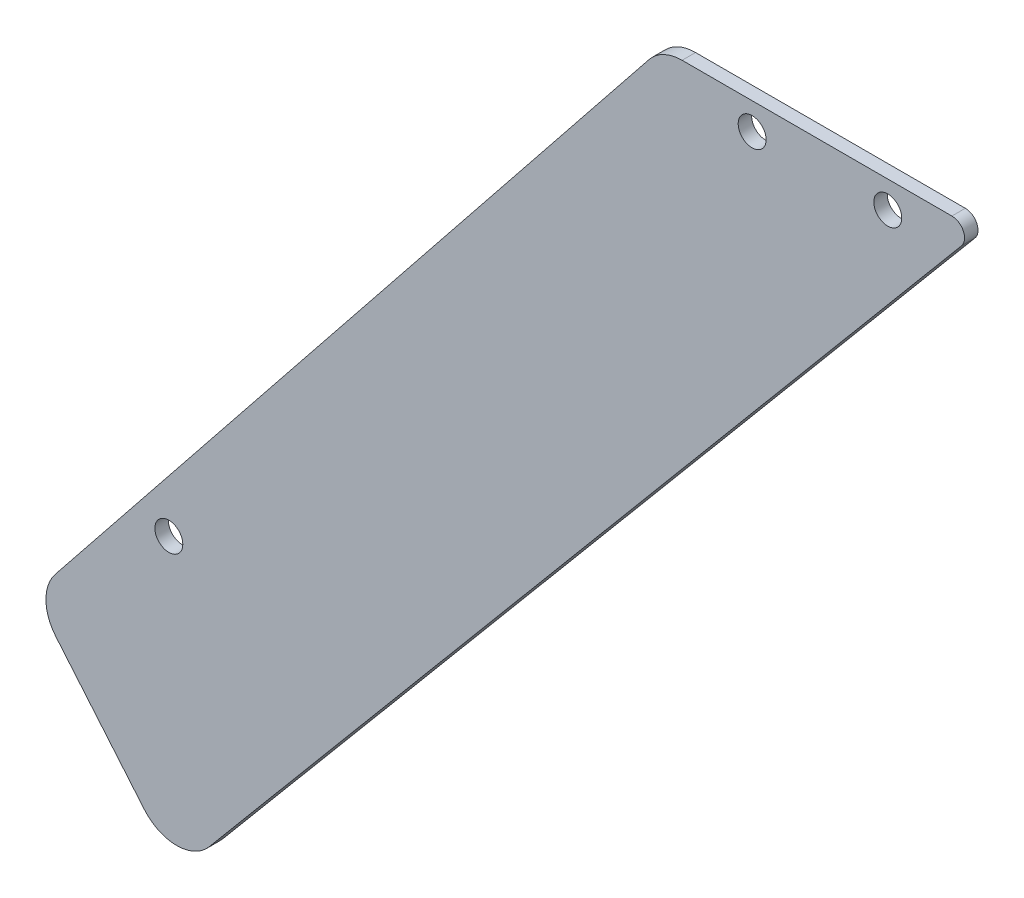
from build123d import *
from OCP.BRepFilletAPI import BRepFilletAPI_MakeFillet

# Parameters (mm, degrees)
SKETCH1_R           = 3.3
BOSS_EXTRUDE1_DEPTH = 3.175
FILLET1_R1          = 10
FILLET1_R2          = 3
SKETCH2_R           = 3.3
CUT_EXTRUDE1_DEPTH  = 263.033344997


with BuildPart() as part:
    # Sketch1 → Boss-Extrude1 (new body)
    with BuildSketch(Plane.XY):
        Polygon((69.512033286, 6.35), (-120.132774221, -219.659880664), (-153.960322951, -179.345777937), (-5.487966714, 6.35), align=None)
        with Locations((47.925, 0)):
            Circle(SKETCH1_R, mode=Mode.SUBTRACT)
        with Locations((15.875, 0)):
            Circle(SKETCH1_R, mode=Mode.SUBTRACT)
    extrude(amount=BOSS_EXTRUDE1_DEPTH)

    # Fillet1: one fillet with a radius per group of edges: ONE call of the kernel's fillet builder (fillet() takes one radius for all edges)
    fillet1_edges_1 = [part.edges().sort_by_distance(p)[0] for p in [
        (-120.132774221, -219.659880664, 1.5875),
        (-153.960322951, -179.345777937, 1.5875),
        (-5.487966714, 6.35, 1.5875),
    ]]
    fillet1_edges_2 = [part.edges().sort_by_distance(p)[0] for p in [
        (69.512033286, 6.35, 1.5875),
    ]]
    fillet1 = BRepFilletAPI_MakeFillet(part.part.solid().wrapped)
    for e in fillet1_edges_1:
        fillet1.Add(FILLET1_R1, e.wrapped)
    for e in fillet1_edges_2:
        fillet1.Add(FILLET1_R2, e.wrapped)
    add(Compound.cast(fillet1.Shape()), mode=Mode.REPLACE)

    # Sketch2 → Cut-Extrude1 (cut, through all)
    with BuildSketch(Plane.XY.offset(3.175)):
        with Locations((-121.989936846, -151.733352159)):
            Circle(SKETCH2_R)
    extrude(amount=-CUT_EXTRUDE1_DEPTH, mode=Mode.SUBTRACT)


solid = part.part
